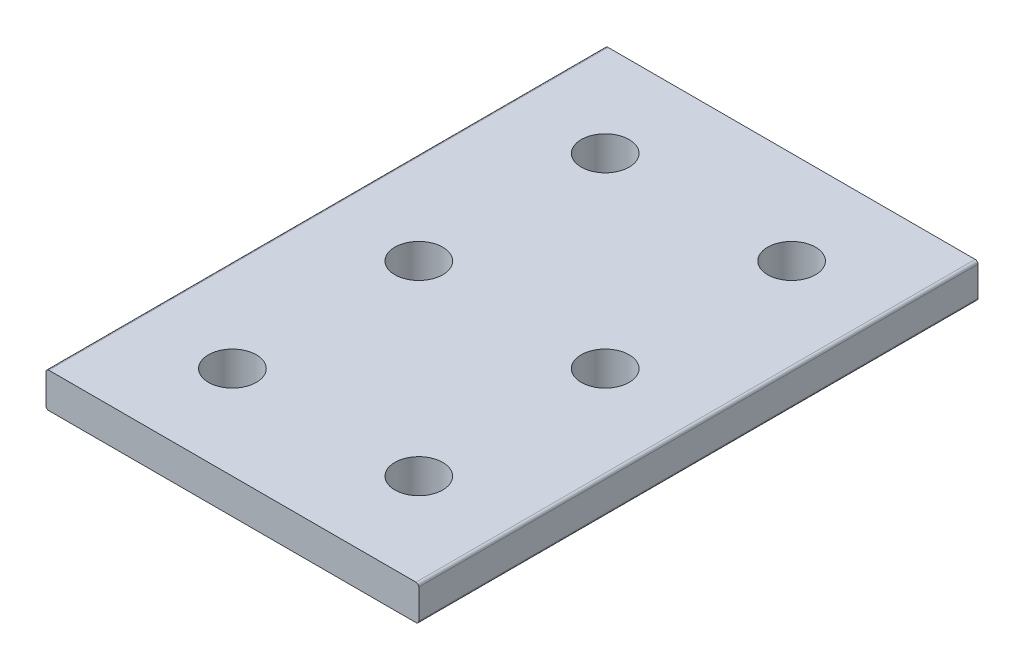
from build123d import *

# Parameters (mm, degrees)
BOSS_EXTRUDE1_OUTLINE_W  = 4.7752
BOSS_EXTRUDE1_OUTLINE_H  = 76.2
BOSS_EXTRUDE1_DEPTH      = 50.8
F_0_257_DIAMETER_HOLE1_D = 6.5278
FILLET1_R                = 0.381
LPATTERN1_COUNT          = 4
LPATTERN1_PITCH          = 25.4
LPATTERN1_COUNT_DIR2     = 2
LPATTERN1_PITCH_DIR2     = 25.4


# Read off the part's stored shape, not the designer's step: Boss-Extrude1
with BuildPart() as part:
    # Boss-Extrude1 outline → Boss-Extrude1 (new body)
    with BuildSketch(Plane.YZ):
        with Locations((2.3876, 38.1)):
            Rectangle(BOSS_EXTRUDE1_OUTLINE_W, BOSS_EXTRUDE1_OUTLINE_H)
    extrude(amount=BOSS_EXTRUDE1_DEPTH)

    # F (0.257) Diameter Hole1 (through all)
    with Locations(Plane(origin=(0, 4.7752, 0), x_dir=(-1, 0, 0), z_dir=(0, 1, 0))):
        with Locations((-38.1, 63.5)):
            f_0_257_diameter_hole1 = Hole(F_0_257_DIAMETER_HOLE1_D / 2)

    # Fillet1
    fillet1_edges = [part.edges().sort_by_distance(p)[0] for p in [
        (50.8, 4.7752, 38.1),
        (0, 4.7752, 38.1),
        (50.8, 0, 38.1),
        (0, 0, 38.1),
    ]]
    fillet(fillet1_edges, radius=FILLET1_R)

    # LPattern1: F _0.257_ Diameter Hole1 4 × 2
    with Locations(*[(-j * LPATTERN1_PITCH_DIR2, 0, -i * LPATTERN1_PITCH) for i in range(LPATTERN1_COUNT) for j in range(LPATTERN1_COUNT_DIR2) if (i, j) != (0, 0)]):
        add(f_0_257_diameter_hole1, mode=Mode.SUBTRACT)


solid = part.part
